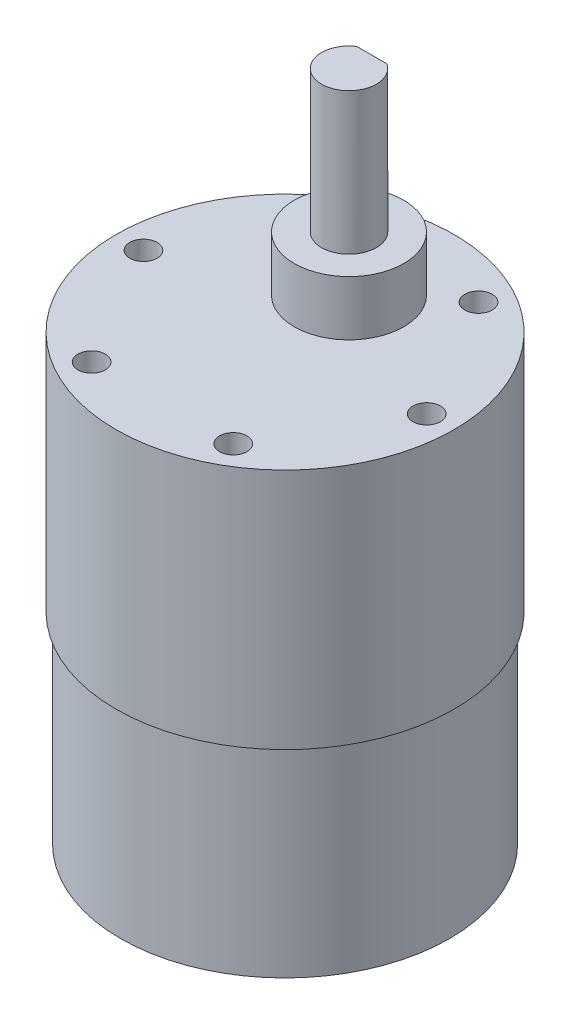
from build123d import *

# Parameters (mm, degrees)
SKETCH2_R               = 18
BOSS_EXTRUDE1_DEPTH     = 22
SKETCH3_R               = 18.5
BOSS_EXTRUDE2_DEPTH     = 26.5
SKETCH4_R               = 1.5
CUT_EXTRUDE1_DEPTH      = 6
CIRPATTERN1_COUNT       = 6
SKETCH5_R               = 6
BOSS_EXTRUDE3_DEPTH     = 6
SKETCH6_R               = 3
BOSS_EXTRUDE4_DEPTH     = 15.5
CUT_EXTRUDE2_DEPTH      = 75.729512242
CUT_EXTRUDE2_DEPTH_BACK = 12


with BuildPart() as part:
    # Sketch2 → Boss-Extrude1 (new body)
    with BuildSketch(Plane(origin=(0, 0, 0), x_dir=(1, 0, 0), z_dir=(0, 1, 0))):
        Circle(SKETCH2_R)
    extrude(amount=BOSS_EXTRUDE1_DEPTH)

    # Sketch3 → Boss-Extrude2 (add)
    with BuildSketch(Plane(origin=(0, 22, 0), x_dir=(1, 0, 0), z_dir=(0, 1, 0))):
        Circle(SKETCH3_R)
    extrude(amount=BOSS_EXTRUDE2_DEPTH)

    # Sketch4 → Cut-Extrude1 (cut)
    with BuildSketch(Plane(origin=(0, 48.5, 0), x_dir=(1, 0, 0), z_dir=(0, 1, 0))):
        with Locations((-15.5, 0)):
            Circle(SKETCH4_R)
    cut_extrude1 = extrude(amount=-CUT_EXTRUDE1_DEPTH, mode=Mode.SUBTRACT)

    # CirPattern1: Cut-Extrude1 ×6 about axis
    cirpattern1_axis = Axis((0, 48.5, 0), (0, 1, 0))
    for i in range(1, CIRPATTERN1_COUNT):
        add(cut_extrude1.rotate(cirpattern1_axis, i * 360 / CIRPATTERN1_COUNT), mode=Mode.SUBTRACT)

    # Sketch5 → Boss-Extrude3 (add)
    with BuildSketch(Plane(origin=(0, 48.5, 0), x_dir=(1, 0, 0), z_dir=(0, 1, 0))):
        with Locations((0, 7)):
            Circle(SKETCH5_R)
    extrude(amount=BOSS_EXTRUDE3_DEPTH)

    # Sketch6 → Boss-Extrude4 (add)
    with BuildSketch(Plane(origin=(0, 54.5, 0), x_dir=(1, 0, 0), z_dir=(0, 1, 0))):
        with Locations((0, 7)):
            Circle(SKETCH6_R)
    extrude(amount=BOSS_EXTRUDE4_DEPTH)

    # Sketch7 → Cut-Extrude2 (cut, two sides: drawn at the far end of the back side and taken through both)
    with BuildSketch(Plane(origin=(0, 70, 0), x_dir=(1, 0, 0), z_dir=(0, 1, 0)).offset(-CUT_EXTRUDE2_DEPTH_BACK)):
        Polygon((-80.661403086, 9.5), (-1.6583, 9.5), (1.6583, 9.5), (80.661403086, 9.5), (80.661403086, 167.506206173), (-80.661403086, 167.506206173), align=None)
    extrude(amount=CUT_EXTRUDE2_DEPTH + CUT_EXTRUDE2_DEPTH_BACK, mode=Mode.SUBTRACT)


solid = part.part
